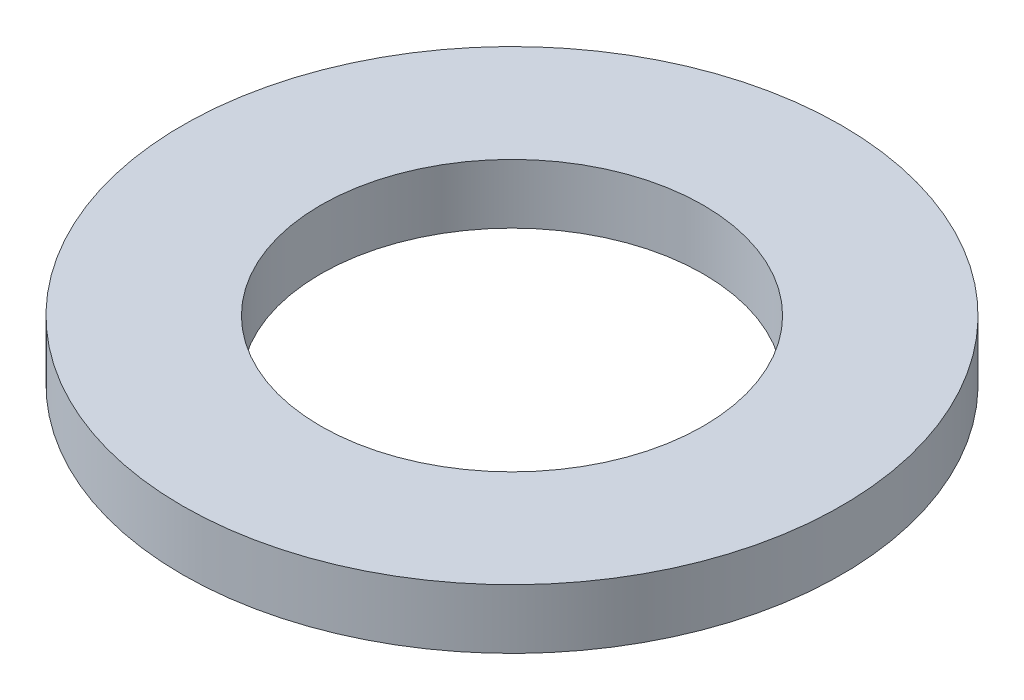
from build123d import *

# Parameters (mm, degrees)
SKETCH1_R           = 77.5
BOSS_EXTRUDE1_DEPTH = 14
SKETCH2_R           = 45
CUT_EXTRUDE1_DEPTH  = 111.492081164


with BuildPart() as part:
    # Sketch1 → Boss-Extrude1 (new body)
    with BuildSketch(Plane(origin=(0, 0, 0), x_dir=(1, 0, 0), z_dir=(0, 1, 0))):
        Circle(SKETCH1_R)
    extrude(amount=BOSS_EXTRUDE1_DEPTH)

    # Sketch2 → Cut-Extrude1 (cut, through all)
    with BuildSketch(Plane(origin=(0, 0, 0), x_dir=(1, 0, 0), z_dir=(0, 1, 0))):
        Circle(SKETCH2_R)
    extrude(amount=CUT_EXTRUDE1_DEPTH, mode=Mode.SUBTRACT)


solid = part.part
